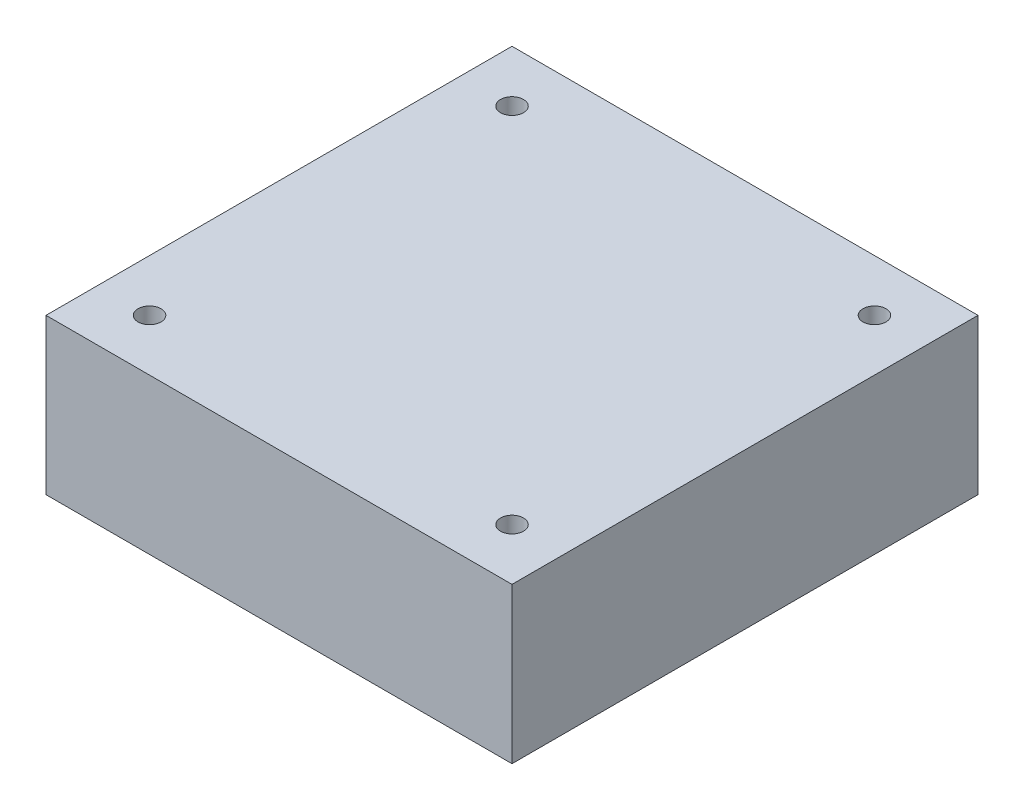
from build123d import *

# Parameters (mm, degrees)
SKETCH11_W          = 81
SKETCH11_H          = 81
BOSS_EXTRUDE1_DEPTH = 27
SKETCH12_R          = 2
CUT_EXTRUDE1_DEPTH  = 64.320612758


with BuildPart() as part:
    # Sketch11 → Boss-Extrude1 (new body)
    with BuildSketch(Plane(origin=(0, 0, 0), x_dir=(1, 0, 0), z_dir=(0, 1, 0))):
        Rectangle(SKETCH11_W, SKETCH11_H)
    extrude(amount=BOSS_EXTRUDE1_DEPTH)

    # Sketch1 → Cut-Revolve1 (revolve, cut)
    with BuildSketch(Plane.XY):
        with BuildLine():
            Line((0, 25), (0, 10))
            Line((0, 10), (0, -10))
            Line((0, -10), (31.5, -10))
            Line((31.5, -10), (31.5, 0))
            add(Edge.make_bspline(
                [(0, 25), (1.37149288, 25), (4.090224786, 24.302680674), (10.751491586, 17.136812446), (25.578767024, 15.070162158), (31.038481607, 6.450242929), (31.5, 0)],
                knots=[0, 0, 0, 0, 0.091245862, 0.195023315, 0.675457006, 1, 1, 1, 1], degree=3))
        make_face()
    revolve(axis=Axis((0, 10, 0), (0, -1, 0)), mode=Mode.SUBTRACT)

    # Sketch12 → Cut-Extrude1 (cut, through all)
    with BuildSketch(Plane.XZ):
        with Locations((-31.5, 31.5)):
            Circle(SKETCH12_R)
        with Locations((31.5, 31.5)):
            Circle(SKETCH12_R)
        with Locations((31.5, -31.5)):
            Circle(SKETCH12_R)
        with Locations((-31.5, -31.5)):
            Circle(SKETCH12_R)
    extrude(amount=-CUT_EXTRUDE1_DEPTH, mode=Mode.SUBTRACT)


solid = part.part
